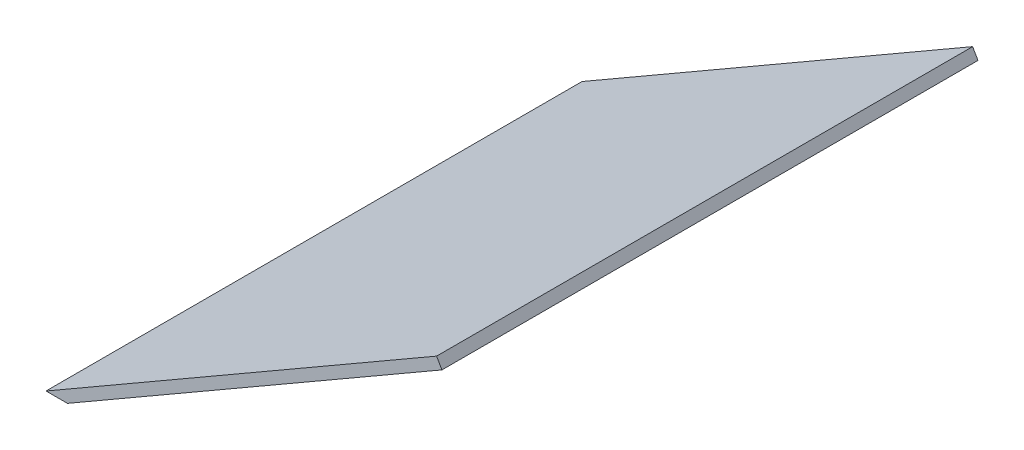
from build123d import *

# Parameters (mm, degrees)
BOSS_EXTRUDE1_DEPTH = 150


with BuildPart() as part:
    # Sketch1 → Boss-Extrude1 (new body)
    with BuildSketch(Plane.XY):
        Polygon((0, 0), (6, 0), (110.797734112, 60.505), (109.297734112, 63.103076211), align=None)
    extrude(amount=BOSS_EXTRUDE1_DEPTH)


solid = part.part
